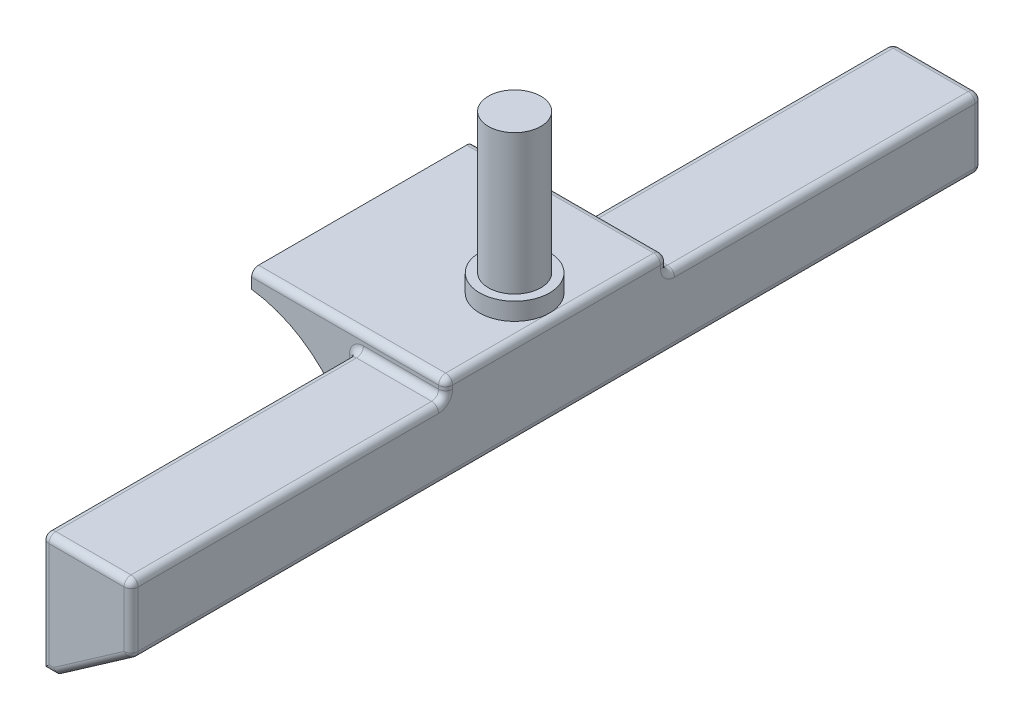
from build123d import *

# Parameters (mm, degrees)
SKETCH1_W                         = 25.5
SKETCH1_H                         = 243.5
SKETCH1_W_2                       = 17.5
SKETCH1_H_2                       = 235.5
MOTOR_PANEL_CONNECTOR_DEPTH       = 34
SKETCH3_W                         = 25.5
SKETCH3_H                         = 243.5
MOTOR_PANEL_CONNECCTOR_BASE_DEPTH = 4
UP_DOWN_CONNECT_CUT_DEPTH         = 250
SKETCH5_W                         = 47.5
SKETCH5_H                         = 31
CUT_TO_NAIL_PART_DEPTH            = 5
SKETCH6_W                         = 55.5
SKETCH6_H                         = 63.5
PANEL_CONNECTOR_DEPTH             = 5
SKETCH7_R                         = 10
BOSS_EXTRUDE4_DEPTH               = 5
BOSS_EXTRUDE5_DEPTH               = 5
BOSS_EXTRUDE6_DEPTH               = 5
SKETCH14_R                        = 7.5
BOSS_EXTRUDE7_DEPTH               = 40
FILLET3_R                         = 2


with BuildPart() as part:
    # Sketch1 → motor -panel connector (new body)
    with BuildSketch(Plane(origin=(0, 0, 0), x_dir=(1, 0, 0), z_dir=(0, 1, 0))):
        with Locations((8.75, -117.75)):
            Rectangle(SKETCH1_W, SKETCH1_H)
        with Locations((8.75, -117.75)):
            Rectangle(SKETCH1_W_2, SKETCH1_H_2, mode=Mode.SUBTRACT)
    extrude(amount=MOTOR_PANEL_CONNECTOR_DEPTH)

    # Sketch3 → motor-panel connecctor base (add)
    with BuildSketch(Plane(origin=(0, 34, 0), x_dir=(1, 0, 0), z_dir=(0, 1, 0))):
        with Locations((8.75, -117.75)):
            Rectangle(SKETCH3_W, SKETCH3_H)
    extrude(amount=-MOTOR_PANEL_CONNECCTOR_BASE_DEPTH)

    # Sketch4 → up down connect cut (cut)
    with BuildSketch(Plane.XY.offset(239.5)):
        Polygon((0, 0), (21.5, 15), (21.5, 0), align=None)
    extrude(amount=-UP_DOWN_CONNECT_CUT_DEPTH, mode=Mode.SUBTRACT)

    # Sketch5 → cut to nail part (cut)
    with BuildSketch(Plane.ZY.offset(4)):
        with Locations((117.75, 15.5)):
            Rectangle(SKETCH5_W, SKETCH5_H)
    extrude(amount=-CUT_TO_NAIL_PART_DEPTH, mode=Mode.SUBTRACT)

    # Sketch6 → panel connector (add)
    with BuildSketch(Plane(origin=(0, 34, 0), x_dir=(1, 0, 0), z_dir=(0, 1, 0))):
        with Locations((-6.25, -117.75)):
            Rectangle(SKETCH6_W, SKETCH6_H)
    extrude(amount=PANEL_CONNECTOR_DEPTH)

    # Sketch7 → Boss-Extrude4 (add)
    with BuildSketch(Plane(origin=(0, 39, 0), x_dir=(1, 0, 0), z_dir=(0, 1, 0))):
        with Locations(Location((9.5, -117.75, 0), (0, 0, 90))):
            Circle(SKETCH7_R)
    extrude(amount=BOSS_EXTRUDE4_DEPTH)

    # Sketch8 → Boss-Extrude5 (add)
    with BuildSketch(Plane.XY.offset(149.5)):
        with BuildLine():
            Line((-34, 34), (-4, 34))
            Line((-4, 34), (-4, 0))
            ThreePointArc((-4, 0), (-12.572222823, 22.671568098), (-34, 34))
        make_face()
    extrude(amount=-BOSS_EXTRUDE5_DEPTH)

    # Sketch13 → Boss-Extrude6 (add)
    with BuildSketch(Plane(origin=(0, 0, 86), x_dir=(-1, 0, 0), z_dir=(0, 0, -1))):
        with BuildLine():
            Line((4, 0), (4, 34))
            Line((4, 34), (34, 34))
            ThreePointArc((34, 34), (12.941232514, 22.345971311), (4, 0))
        make_face()
    extrude(amount=-BOSS_EXTRUDE6_DEPTH)

    # Sketch14 → Boss-Extrude7 (add)
    with BuildSketch(Plane(origin=(0, 44, 0), x_dir=(1, 0, 0), z_dir=(0, 1, 0))):
        with Locations(Location((9.5, -117.75, 0), (0, 0, 270))):
            Circle(SKETCH14_R)
    extrude(amount=BOSS_EXTRUDE7_DEPTH)

    # Fillet3
    # the kernel refuses this fillet: 2 mm, written as the material it takes off along each edge
    with BuildSketch(Plane(origin=(-2, 32, 237.5), x_dir=(-1, 0, 0), z_dir=(0, 1, 0))) as fillet3_piece_1_section:
        Polygon((0, 0), (FILLET3_R * 1.02, 0), (FILLET3_R * 1.02, FILLET3_R * 1.02), (0, FILLET3_R * 1.02), align=None)
    fillet3_piece_1 = extrude(amount=FILLET3_R * 1.02, mode=Mode.PRIVATE)
    fillet3_piece_1 = fillet3_piece_1 - Plane(origin=(-2, 32, 237.5), x_dir=(0.7071067811865475, 0, -0.7071067811865475), z_dir=(0, 1, 0)) * Sphere(FILLET3_R, mode=Mode.PRIVATE)
    add(fillet3_piece_1, mode=Mode.SUBTRACT)
    with BuildSketch(Plane(origin=(-2, 32, -2), x_dir=(0, 1, 0), z_dir=(-1, 0, 0))) as fillet3_piece_2_section:
        Polygon((0, 0), (FILLET3_R * 1.02, 0), (FILLET3_R * 1.02, FILLET3_R * 1.02), (0, FILLET3_R * 1.02), align=None)
    fillet3_piece_2 = extrude(amount=FILLET3_R * 1.02, mode=Mode.PRIVATE)
    fillet3_piece_2 = fillet3_piece_2 - Plane(origin=(-2, 32, -2), x_dir=(0, -0.7071067811865475, 0.7071067811865475), z_dir=(-1, 0, 0)) * Sphere(FILLET3_R, mode=Mode.PRIVATE)
    add(fillet3_piece_2, mode=Mode.SUBTRACT)
    with BuildSketch(Plane(origin=(19.5, 16.043297996, 237.5), x_dir=(0.5721815960240814, -0.8201269543011832, 0), z_dir=(0, 0, 1))) as fillet3_piece_3_section:
        Polygon((0, 0), (FILLET3_R * 1.02, 0), (FILLET3_R * 1.02, FILLET3_R * 0.532081978), (FILLET3_R * 0.583625227945, FILLET3_R * 0.836529493387), align=None)
    fillet3_piece_3 = extrude(amount=FILLET3_R * 1.02, mode=Mode.PRIVATE)
    fillet3_piece_3 = fillet3_piece_3 - Plane(origin=(19.5, 16.043297996, 237.5), x_dir=(-0.886617616569872, 0.4625031913273241, 0), z_dir=(0, 0, 1)) * Sphere(FILLET3_R, mode=Mode.PRIVATE)
    add(fillet3_piece_3, mode=Mode.SUBTRACT)
    with BuildSketch(Plane(origin=(19.5, 16.043297996, -2), x_dir=(0.5721815960240814, -0.8201269543011832, 0), z_dir=(0, 0, -1))) as fillet3_piece_4_section:
        Polygon((0, 0), (FILLET3_R * 1.02, 0), (FILLET3_R * 1.02, -FILLET3_R * 0.532081978), (FILLET3_R * 0.583625227945, -FILLET3_R * 0.836529493387), align=None)
    fillet3_piece_4 = extrude(amount=FILLET3_R * 1.02, mode=Mode.PRIVATE)
    fillet3_piece_4 = fillet3_piece_4 - Plane(origin=(19.5, 16.043297996, -2), x_dir=(-0.886617616569872, 0.4625031913273241, 0), z_dir=(0, 0, -1)) * Sphere(FILLET3_R, mode=Mode.PRIVATE)
    add(fillet3_piece_4, mode=Mode.SUBTRACT)
    with BuildSketch(Plane(origin=(21.5, 39, 154.5), x_dir=(0, -1, 0), z_dir=(0, 0, -1))) as fillet3_piece_5:
        with BuildLine():
            CenterArc((FILLET3_R, FILLET3_R), FILLET3_R, 180, 90)
            Line((0, FILLET3_R), (0, 0))
            Line((0, 0), (FILLET3_R, 0))
        make_face()
    extrude(amount=73.5, mode=Mode.SUBTRACT)
    with BuildSketch(Plane(origin=(26.5, 39, 86), x_dir=(0, -1, 0), z_dir=(-1, 0, 0))) as fillet3_piece_6:
        with BuildLine():
            CenterArc((FILLET3_R, FILLET3_R), FILLET3_R, 180, 90)
            Line((0, FILLET3_R), (0, 0))
            Line((0, 0), (FILLET3_R, 0))
        make_face()
    extrude(amount=65.5, mode=Mode.SUBTRACT)
    with BuildSketch(Plane(origin=(-39, 39, 149.5), x_dir=(0, 0, -1), z_dir=(1, 0, 0))) as fillet3_piece_7:
        with BuildLine():
            CenterArc((FILLET3_R, -FILLET3_R), FILLET3_R, 90, 90)
            Line((0, -FILLET3_R), (0, 0))
            Line((0, 0), (FILLET3_R, 0))
        make_face()
    extrude(amount=65.5, mode=Mode.SUBTRACT)
    with BuildSketch(Plane(origin=(-2, 34, 239.5), x_dir=(0, -1, 0), z_dir=(1, 0, 0))) as fillet3_piece_8:
        with BuildLine():
            CenterArc((FILLET3_R, FILLET3_R), FILLET3_R, 180, 90)
            Line((0, FILLET3_R), (0, 0))
            Line((0, 0), (FILLET3_R, 0))
        make_face()
    extrude(amount=28.5, mode=Mode.SUBTRACT)
    with BuildSketch(Plane(origin=(26.5, 34, -4), x_dir=(0, 0, 1), z_dir=(-1, 0, 0))) as fillet3_piece_9:
        with BuildLine():
            CenterArc((FILLET3_R, -FILLET3_R), FILLET3_R, 90, 90)
            Line((0, -FILLET3_R), (0, 0))
            Line((0, 0), (FILLET3_R, 0))
        make_face()
    extrude(amount=28.5, mode=Mode.SUBTRACT)
    with BuildSketch(Plane(origin=(21.5, 15, 237.5), x_dir=(-0.8201269543011818, -0.5721815960240832, 0), z_dir=(0, 0, -1))) as fillet3_piece_10:
        with BuildLine():
            CenterArc((FILLET3_R * 0.521648998039, FILLET3_R), FILLET3_R, 214.902495616, 55.097504384)
            Line((-FILLET3_R * 0.298477956262, FILLET3_R * 0.427818403976), (0, 0))
            Line((0, 0), (FILLET3_R * 0.521648998039, 0))
        make_face()
    extrude(amount=239.5, mode=Mode.SUBTRACT)
    with BuildSketch(Plane(origin=(-9, 0, 239.5), x_dir=(0, 1, 0), z_dir=(1, 0, 0))) as fillet3_piece_11:
        with BuildLine():
            CenterArc((FILLET3_R, -FILLET3_R), FILLET3_R, 90, 90)
            Line((0, -FILLET3_R), (0, 0))
            Line((0, 0), (FILLET3_R, 0))
        make_face()
    extrude(amount=14, mode=Mode.SUBTRACT)
    with BuildSketch(Plane(origin=(5, 0, -4), x_dir=(0, 0, 1), z_dir=(-1, 0, 0))) as fillet3_piece_12:
        with BuildLine():
            CenterArc((FILLET3_R, FILLET3_R), FILLET3_R, 180, 90)
            Line((0, FILLET3_R), (0, 0))
            Line((0, 0), (FILLET3_R, 0))
        make_face()
    extrude(amount=14, mode=Mode.SUBTRACT)
    with BuildSketch(Plane(origin=(-4.100634772, -2.86090798, -4), x_dir=(-0.5721815960240814, 0.8201269543011832, 0), z_dir=(0.8201269543011832, 0.5721815960240814, 0)), Plane(origin=(-4.100634772, -2.86090798, 239.5), x_dir=(0, 0, -1), z_dir=(0.8201269543011832, 0.5721815960240814, 0))) as fillet3_piece_13:
        with BuildLine():
            CenterArc((FILLET3_R, FILLET3_R), FILLET3_R, 180, 90)
            Line((0, FILLET3_R), (0, 0))
            Line((0, 0), (FILLET3_R, 0))
        make_face()
    extrude(amount=30.172155462, mode=Mode.SUBTRACT)
    with BuildSketch(Plane(origin=(21.5, 39, -4), x_dir=(-1, 0, 0), z_dir=(0, -1, 0))) as fillet3_piece_14:
        with BuildLine():
            CenterArc((FILLET3_R, -FILLET3_R), FILLET3_R, 90, 90)
            Line((0, -FILLET3_R), (0, 0))
            Line((0, 0), (FILLET3_R, 0))
        make_face()
    extrude(amount=22.956702004, mode=Mode.SUBTRACT)
    with BuildSketch(Plane(origin=(21.5, 16.043297996, 239.5), x_dir=(0, 0, -1), z_dir=(0, 1, 0))) as fillet3_piece_15:
        with BuildLine():
            CenterArc((FILLET3_R, FILLET3_R), FILLET3_R, 180, 90)
            Line((0, FILLET3_R), (0, 0))
            Line((0, 0), (FILLET3_R, 0))
        make_face()
    extrude(amount=22.956702004, mode=Mode.SUBTRACT)
    with BuildSketch(Plane(origin=(-4, -5, 239.5), x_dir=(1, 0, 0), z_dir=(0, 1, 0))) as fillet3_piece_16:
        with BuildLine():
            CenterArc((FILLET3_R, FILLET3_R), FILLET3_R, 180, 90)
            Line((0, FILLET3_R), (0, 0))
            Line((0, 0), (FILLET3_R, 0))
        make_face()
    extrude(amount=37, mode=Mode.SUBTRACT)
    with BuildSketch(Plane(origin=(-4, 32, -4), x_dir=(0, 0, 1), z_dir=(0, -1, 0))) as fillet3_piece_17:
        with BuildLine():
            CenterArc((FILLET3_R, -FILLET3_R), FILLET3_R, 90, 90)
            Line((0, -FILLET3_R), (0, 0))
            Line((0, 0), (FILLET3_R, 0))
        make_face()
    extrude(amount=37, mode=Mode.SUBTRACT)
    with BuildSketch(Plane(origin=(-4, 34, -2), x_dir=(0, -1, 0), z_dir=(0, 0, 1))) as fillet3_piece_18:
        with BuildLine():
            CenterArc((FILLET3_R, FILLET3_R), FILLET3_R, 180, 90)
            Line((0, FILLET3_R), (0, 0))
            Line((0, 0), (FILLET3_R, 0))
        make_face()
    extrude(amount=88, mode=Mode.SUBTRACT)
    with BuildSketch(Plane(origin=(-4, 34, 149.5), x_dir=(1, 0, 0), z_dir=(0, 0, 1))) as fillet3_piece_19:
        with BuildLine():
            CenterArc((FILLET3_R, -FILLET3_R), FILLET3_R, 90, 90)
            Line((0, -FILLET3_R), (0, 0))
            Line((0, 0), (FILLET3_R, 0))
        make_face()
    extrude(amount=88, mode=Mode.SUBTRACT)
    # the kernel refuses this fillet: 2 mm, written as the material it adds along each edge
    with BuildSketch(Plane(origin=(-4, 32, 149.5), x_dir=(-1, 0, 0), z_dir=(0, -1, 0))) as fillet3_2_piece_1_section:
        with BuildLine():
            CenterArc((FILLET3_R, -FILLET3_R), FILLET3_R, 90, 90)
            Line((0, -FILLET3_R), (0, 0))
            Line((0, 0), (FILLET3_R, 0))
        make_face()
    fillet3_2_piece_1 = extrude(amount=32, mode=Mode.PRIVATE)
    fillet3_2_piece_1 = fillet3_2_piece_1 - Plane(origin=(-38.266666667, 0, 149.967222139), x_dir=(1, 0, 0), z_dir=(0, 0, 1)) * Cylinder(34.266666667, 72, mode=Mode.PRIVATE)
    add(fillet3_2_piece_1)
    with BuildSketch(Plane(origin=(-4, 0, 86), x_dir=(0, 0, -1), z_dir=(0, 1, 0))) as fillet3_2_piece_2_section:
        with BuildLine():
            CenterArc((FILLET3_R, FILLET3_R), FILLET3_R, 180, 90)
            Line((0, FILLET3_R), (0, 0))
            Line((0, 0), (FILLET3_R, 0))
        make_face()
    fillet3_2_piece_2 = extrude(amount=32, mode=Mode.PRIVATE)
    fillet3_2_piece_2 = fillet3_2_piece_2 - Plane(origin=(-39.820351429, -1.370898319, 85.534344582), x_dir=(0.16236841120732118, 0.9867302058019762, 0), z_dir=(0, 0, -1)) * Cylinder(35.846574992, 73, mode=Mode.PRIVATE)
    add(fillet3_2_piece_2)
    with BuildSketch(Plane(origin=(-2, 34, 149.5), x_dir=(0, 1, 0), z_dir=(1, 0, 0)), Plane(origin=(21.5, 34, 86), x_dir=(0, 1, 0), z_dir=(-1, 0, 0))) as fillet3_2_piece_3:
        with BuildLine():
            CenterArc((FILLET3_R, FILLET3_R), FILLET3_R, 180, 90)
            Line((0, FILLET3_R), (0, 0))
            Line((0, 0), (FILLET3_R, 0))
        make_face()
    extrude(amount=23.5)
    with BuildSketch(Plane(origin=(-2, 32, 86), x_dir=(-1, 0, 0), z_dir=(0, -1, 0))) as fillet3_2_piece_4:
        with BuildLine():
            CenterArc((2 + FILLET3_R, FILLET3_R), FILLET3_R, 180, 90)
            Line((2, FILLET3_R), (2, 0))
            Line((2, 0), (2 + FILLET3_R, 0))
        make_face()
    revolve(axis=Axis((-2, 32, 86), (0, 0, -1)), revolution_arc=90)
    with BuildSketch(Plane(origin=(-2, 32, 149.5), x_dir=(0, 1, 0), z_dir=(1, 0, 0))) as fillet3_2_piece_5:
        with BuildLine():
            CenterArc((2 + FILLET3_R, FILLET3_R), FILLET3_R, 180, 90)
            Line((2, FILLET3_R), (2, 0))
            Line((2, 0), (2 + FILLET3_R, 0))
        make_face()
    revolve(axis=Axis((-2, 32, 149.5), (0, 0, 1)), revolution_arc=90)
    # the kernel refuses this fillet: 2 mm, written as the material it takes off along each edge
    with BuildSketch(Plane(origin=(19.5, 37, 88), x_dir=(0, 0, -1), z_dir=(1, 0, 0))) as fillet3_3_piece_1_section:
        Polygon((0, 0), (FILLET3_R * 1.02, 0), (FILLET3_R * 1.02, FILLET3_R * 1.02), (0, FILLET3_R * 1.02), align=None)
    fillet3_3_piece_1 = extrude(amount=FILLET3_R * 1.02, mode=Mode.PRIVATE)
    fillet3_3_piece_1 = fillet3_3_piece_1 - Plane(origin=(19.5, 37, 88), x_dir=(0, -0.7071067811865475, 0.7071067811865475), z_dir=(1, 0, 0)) * Sphere(FILLET3_R, mode=Mode.PRIVATE)
    add(fillet3_3_piece_1, mode=Mode.SUBTRACT)
    with BuildSketch(Plane(origin=(19.5, 37, 147.5), x_dir=(0, 0, 1), z_dir=(1, 0, 0))) as fillet3_3_piece_2_section:
        Polygon((0, 0), (FILLET3_R * 1.02, 0), (FILLET3_R * 1.02, -FILLET3_R * 1.02), (0, -FILLET3_R * 1.02), align=None)
    fillet3_3_piece_2 = extrude(amount=FILLET3_R * 1.02, mode=Mode.PRIVATE)
    fillet3_3_piece_2 = fillet3_3_piece_2 - Plane(origin=(19.5, 37, 147.5), x_dir=(0, -0.7071067811865475, -0.7071067811865475), z_dir=(1, 0, 0)) * Sphere(FILLET3_R, mode=Mode.PRIVATE)
    add(fillet3_3_piece_2, mode=Mode.SUBTRACT)
    with BuildSketch(Plane(origin=(19.5, 32, -2), x_dir=(0, 1, 0), z_dir=(1, 0, 0))) as fillet3_3_piece_3_section:
        Polygon((0, 0), (FILLET3_R * 1.02, 0), (FILLET3_R * 1.02, -FILLET3_R * 1.02), (0, -FILLET3_R * 1.02), align=None)
    fillet3_3_piece_3 = extrude(amount=FILLET3_R * 1.02, mode=Mode.PRIVATE)
    fillet3_3_piece_3 = fillet3_3_piece_3 - Plane(origin=(19.5, 32, -2), x_dir=(0, -0.7071067811865475, 0.7071067811865475), z_dir=(1, 0, 0)) * Sphere(FILLET3_R, mode=Mode.PRIVATE)
    add(fillet3_3_piece_3, mode=Mode.SUBTRACT)
    with BuildSketch(Plane(origin=(19.5, 32, 237.5), x_dir=(0, 1, 0), z_dir=(1, 0, 0))) as fillet3_3_piece_4_section:
        Polygon((0, 0), (FILLET3_R * 1.02, 0), (FILLET3_R * 1.02, FILLET3_R * 1.02), (0, FILLET3_R * 1.02), align=None)
    fillet3_3_piece_4 = extrude(amount=FILLET3_R * 1.02, mode=Mode.PRIVATE)
    fillet3_3_piece_4 = fillet3_3_piece_4 - Plane(origin=(19.5, 32, 237.5), x_dir=(0, -0.7071067811865475, -0.7071067811865475), z_dir=(1, 0, 0)) * Sphere(FILLET3_R, mode=Mode.PRIVATE)
    add(fillet3_3_piece_4, mode=Mode.SUBTRACT)
    with BuildSketch(Plane(origin=(21.5, 34, 237.5), x_dir=(0, -1, 0), z_dir=(0, 0, -1)), Plane(origin=(21.5, 34, 84), x_dir=(0, -1, 0), z_dir=(0, 0, -1))) as fillet3_3_piece_5:
        with BuildLine():
            CenterArc((FILLET3_R, FILLET3_R), FILLET3_R, 180, 90)
            Line((0, FILLET3_R), (0, 0))
            Line((0, 0), (FILLET3_R, 0))
        make_face()
    extrude(amount=86, mode=Mode.SUBTRACT)
    with BuildSketch(Plane(origin=(21.5, 36, 149.5), x_dir=(0, 0, -1), z_dir=(0, 1, 0))) as fillet3_3_piece_6:
        with BuildLine():
            CenterArc((FILLET3_R, FILLET3_R), FILLET3_R, 180, 90)
            Line((0, FILLET3_R), (0, 0))
            Line((0, 0), (FILLET3_R, 0))
        make_face()
    extrude(amount=1, mode=Mode.SUBTRACT)
    with BuildSketch(Plane(origin=(21.5, 36, 86), x_dir=(0, 0, 1), z_dir=(0, 1, 0))) as fillet3_3_piece_7:
        with BuildLine():
            CenterArc((FILLET3_R, -FILLET3_R), FILLET3_R, 90, 90)
            Line((0, -FILLET3_R), (0, 0))
            Line((0, 0), (FILLET3_R, 0))
        make_face()
    extrude(amount=1, mode=Mode.SUBTRACT)
    with BuildSketch(Plane(origin=(21.5, 36, 84), x_dir=(0, 0, 1), z_dir=(0, 1, 0))) as fillet3_3_piece_8:
        with BuildLine():
            CenterArc((2 + FILLET3_R, -FILLET3_R), FILLET3_R, 90, 90)
            Line((2, -FILLET3_R), (2, 0))
            Line((2, 0), (2 + FILLET3_R, 0))
        make_face()
    revolve(axis=Axis((21.5, 36, 84), (1, 0, 0)), revolution_arc=90, mode=Mode.SUBTRACT)
    with BuildSketch(Plane(origin=(21.5, 36, 151.5), x_dir=(0, 0, -1), z_dir=(0, 1, 0))) as fillet3_3_piece_9:
        with BuildLine():
            CenterArc((2 + FILLET3_R, FILLET3_R), FILLET3_R, 180, 90)
            Line((2, FILLET3_R), (2, 0))
            Line((2, 0), (2 + FILLET3_R, 0))
        make_face()
    revolve(axis=Axis((21.5, 36, 151.5), (-1, 0, 0)), revolution_arc=90, mode=Mode.SUBTRACT)


solid = part.part
